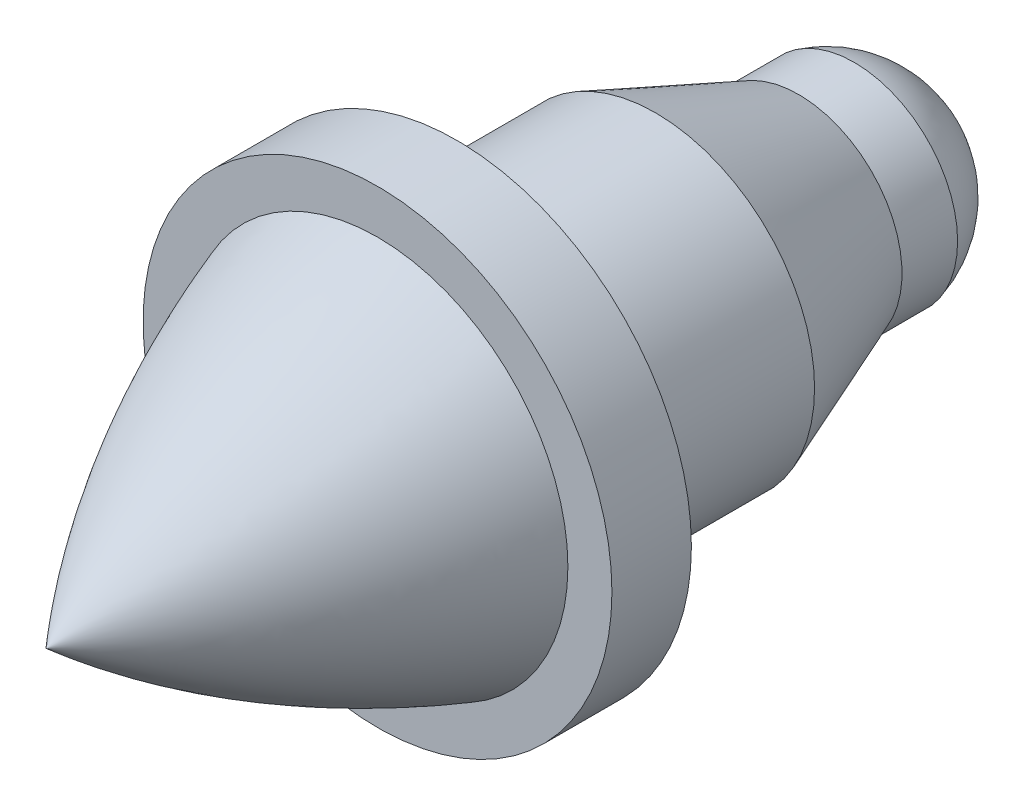
from build123d import *

# Parameters (mm, degrees)
DOME1_FACE_RADIUS = 3.302
DOME1_HEIGHT      = 2.54


# Read off the part's stored shape, not the designer's step: Cut-Revolve-Thin7
with BuildPart() as part:
    # Sketch2 → Revolve1 (revolve)
    with BuildSketch(Plane(origin=(0, 0, 0), x_dir=(0, 0, -1), z_dir=(1, 0, 0)), mode=Mode.PRIVATE) as revolve1_sk:
        Polygon((-8.853714286, 0), (-8.853714286, 7.493), (-6.313714286, 7.493), (-6.313714286, 5.08), (6.386285714, 5.08), (6.386285714, 0), align=None)
    revolve(revolve1_sk.sketch.rotate(Axis((0, 0, 17.845728077), (0, 0, -1)), 90), axis=Axis((0, 0, 17.845728077), (0, 0, -1)))

    # Sketch3 → Revolve2 (revolve)
    with BuildSketch(Plane(origin=(0, 0, 0), x_dir=(0, 0, -1), z_dir=(1, 0, 0))):
        with BuildLine():
            Line((-19.449560173, 0), (-8.853714286, 0))
            Line((-8.853714286, 0), (-8.853714286, 6.085655059))
            add(Edge.make_bspline(
                [(-8.853714286, 6.085655059), (-14.817702659, 4.020762633), (-19.449560173, 0)],
                knots=[0, 0, 0, 1, 1, 1], degree=2))
        make_face()
    revolve(axis=Axis((0, 0, 19.449560173), (0, 0, -1)))

    # Cut-Revolve-Thin7 outline → Cut-Revolve-Thin7 (revolve, cut)
    with BuildSketch(Plane.XZ):
        Polygon((5.08, -0.036285714), (3.302, -4.608285714), (3.302, -6.386285714), (5.08, -6.386285714), align=None)
    revolve(axis=Axis((0, 0, 0), (0, 0, 1)), mode=Mode.SUBTRACT)

    # Dome1: a dome of height H over a round flat face of radius A is a cap of a sphere of radius (A * A + H * H) / (2 * H)
    dome1_r = (DOME1_FACE_RADIUS * DOME1_FACE_RADIUS + DOME1_HEIGHT * DOME1_HEIGHT) / (2 * DOME1_HEIGHT)
    dome1_base = Plane((0, 0, -6.386285714), z_dir=(0, 0, -1))
    with Locations(dome1_base.offset(DOME1_HEIGHT - dome1_r)):
        dome1_ball = Sphere(dome1_r, mode=Mode.PRIVATE)
    add(split(dome1_ball, bisect_by=dome1_base, keep=Keep.TOP, mode=Mode.PRIVATE))


solid = part.part
